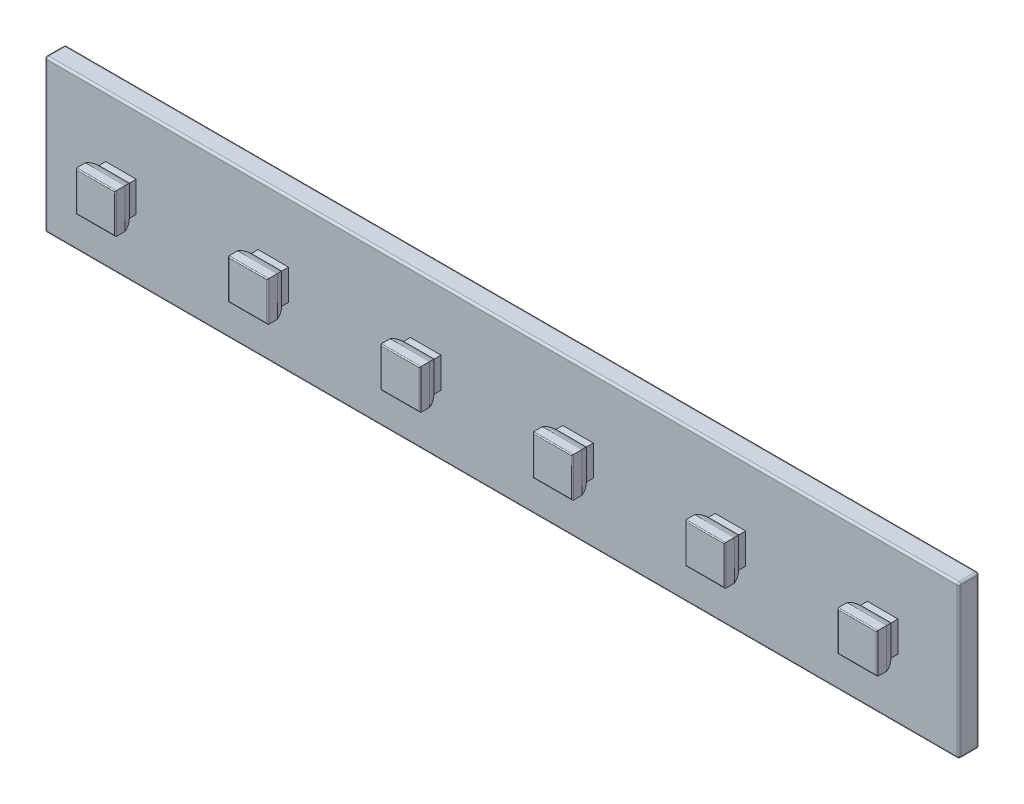
from build123d import *

# Parameters (mm, degrees)
SKETCH_1_W                      = 90
SKETCH_1_H                      = 15
EXTRUDE_1_DEPTH                 = 2
SKETCH_2_W                      = 3
SKETCH_2_H                      = 3
EXTRUDE_2_DEPTH                 = 1
EXTRUDE_3_DEPTH                 = 2
CUT_EXTRUDE_1_REACH             = 84.878
CUT_EXTRUDE_1_DIRECTION_2_REACH = 84.878
FILLET_1_R                      = 0.1
FILLET_1_OF_MIRROR_1_R          = 0.1
FILLET_1_OF_MIRROR_3_R          = 0.1
FILLET_2_R                      = 0.2


# Read off the part's stored shape, not the designer's step: 镜向4
with BuildPart() as part:
    # 草图1 → 凸台-拉伸1 (new body)
    with BuildSketch(Plane.XY):
        with Locations((37.5, 0)):
            Rectangle(SKETCH_1_W, SKETCH_1_H)
    extrude(amount=-EXTRUDE_1_DEPTH)

    # 草图2 → 凸台-拉伸2 (add)
    with BuildSketch(Plane.XY):
        Rectangle(SKETCH_2_W, SKETCH_2_H)
    extrude_2 = extrude(amount=EXTRUDE_2_DEPTH)

    # 草图3 → 凸台-拉伸3 (add, symmetric)
    with BuildSketch(Plane(origin=(0, 0, 0), x_dir=(1, 0, 0), z_dir=(0, 1, 0))):
        with BuildLine():
            Line((-1.95, -2.5), (1.95, -2.5))
            Line((1.95, -2.5), (1.95, -1.555590279))
            ThreePointArc((1.95, -1.555590279), (1.780042303, -1.088161527), (1.5, -0.677124344))
            Line((1.5, -0.677124344), (-1.5, -0.677124344))
            ThreePointArc((-1.5, -0.677124344), (-1.780042303, -1.088161527), (-1.95, -1.555590279))
            Line((-1.95, -1.555590279), (-1.95, -2.5))
        make_face()
    extrude_3 = extrude(amount=EXTRUDE_3_DEPTH, both=True)

    # 草图4 → 切除-拉伸1 (cut, up to next)
    with BuildSketch(Plane(origin=(0, 0, 0), x_dir=(0, 0, -1), z_dir=(1, 0, 0)), mode=Mode.PRIVATE) as cut_extrude_1_sk1:
        with BuildLine():
            Line((-2.5, 1.95), (-1.555590279, 1.95))
            ThreePointArc((-1.555590279, 1.95), (-1.088161527, 1.780042303), (-0.677124344, 1.5))
            Line((-0.677124344, 1.5), (-0.677124344, 2))
            Line((-0.677124344, 2), (-2.5, 2))
            Line((-2.5, 2), (-2.5, 1.95))
        make_face()
    cut_extrude_1_tool1 = extrude(cut_extrude_1_sk1.sketch, amount=-CUT_EXTRUDE_1_REACH, mode=Mode.PRIVATE) & part.part
    # 草图4 → 切除-拉伸1 (cut, up to next)
    with BuildSketch(Plane(origin=(0, 0, 0), x_dir=(0, 0, -1), z_dir=(1, 0, 0)), mode=Mode.PRIVATE) as cut_extrude_1_sk2:
        with BuildLine():
            Line((-2.5, -2), (-0.677124344, -2))
            Line((-0.677124344, -2), (-0.677124344, -1.5))
            ThreePointArc((-0.677124344, -1.5), (-1.088161527, -1.780042303), (-1.555590279, -1.95))
            Line((-1.555590279, -1.95), (-2.5, -1.95))
            Line((-2.5, -1.95), (-2.5, -2))
        make_face()
    cut_extrude_1_tool2 = extrude(cut_extrude_1_sk2.sketch, amount=-CUT_EXTRUDE_1_REACH, mode=Mode.PRIVATE) & part.part
    cut_extrude_1_1 = cut_extrude_1_tool1.solids().sort_by_distance((0, 1.873038, 1.175075))[0]
    add(cut_extrude_1_1, mode=Mode.SUBTRACT)
    cut_extrude_1_2 = cut_extrude_1_tool2.solids().sort_by_distance((0, -1.873038, 1.175075))[0]
    add(cut_extrude_1_2, mode=Mode.SUBTRACT)
    cut_extrude_1 = cut_extrude_1_1 + cut_extrude_1_2  # 切除-拉伸1 as one shape, for the pattern or mirror that repeats it

    # 草图4 → 切除-拉伸1 direction 2 (cut, up to next)
    with BuildSketch(Plane(origin=(0, 0, 0), x_dir=(0, 0, -1), z_dir=(1, 0, 0)), mode=Mode.PRIVATE) as cut_extrude_1_direction_2_sk1:
        with BuildLine():
            Line((-2.5, 1.95), (-1.555590279, 1.95))
            ThreePointArc((-1.555590279, 1.95), (-1.088161527, 1.780042303), (-0.677124344, 1.5))
            Line((-0.677124344, 1.5), (-0.677124344, 2))
            Line((-0.677124344, 2), (-2.5, 2))
            Line((-2.5, 2), (-2.5, 1.95))
        make_face()
    cut_extrude_1_direction_2_tool1 = extrude(cut_extrude_1_direction_2_sk1.sketch, amount=CUT_EXTRUDE_1_DIRECTION_2_REACH, mode=Mode.PRIVATE) & part.part
    # 草图4 → 切除-拉伸1 direction 2 (cut, up to next)
    with BuildSketch(Plane(origin=(0, 0, 0), x_dir=(0, 0, -1), z_dir=(1, 0, 0)), mode=Mode.PRIVATE) as cut_extrude_1_direction_2_sk2:
        with BuildLine():
            Line((-2.5, -2), (-0.677124344, -2))
            Line((-0.677124344, -2), (-0.677124344, -1.5))
            ThreePointArc((-0.677124344, -1.5), (-1.088161527, -1.780042303), (-1.555590279, -1.95))
            Line((-1.555590279, -1.95), (-2.5, -1.95))
            Line((-2.5, -1.95), (-2.5, -2))
        make_face()
    cut_extrude_1_direction_2_tool2 = extrude(cut_extrude_1_direction_2_sk2.sketch, amount=CUT_EXTRUDE_1_DIRECTION_2_REACH, mode=Mode.PRIVATE) & part.part
    cut_extrude_1_direction_2_1 = cut_extrude_1_direction_2_tool1.solids().sort_by_distance((0, 1.873038, 1.175075))[0]
    add(cut_extrude_1_direction_2_1, mode=Mode.SUBTRACT)
    cut_extrude_1_direction_2_2 = cut_extrude_1_direction_2_tool2.solids().sort_by_distance((0, -1.873038, 1.175075))[0]
    add(cut_extrude_1_direction_2_2, mode=Mode.SUBTRACT)
    cut_extrude_1_direction_2 = cut_extrude_1_direction_2_1 + cut_extrude_1_direction_2_2  # 切除-拉伸1 direction 2 as one shape, for the pattern or mirror that repeats it

    # 圆角1
    fillet_1_edges = [part.edges().sort_by_distance(p)[0] for p in [
        (-1.95, 0, 2.5),
        (1.95, 0, 2.5),
        (0, -1.95, 2.5),
        (0, 1.95, 2.5),
    ]]
    fillet(fillet_1_edges, radius=FILLET_1_R)

    # 镜向1: 凸台-拉伸2, 凸台-拉伸3, 切除-拉伸1, 切除-拉伸1 direction 2 across plane
    add(extrude_2.mirror(Plane(origin=(7.5, 0, 0), x_dir=(0, 0, 1), z_dir=(1, 0, 0))))
    add(extrude_3.mirror(Plane(origin=(7.5, 0, 0), x_dir=(0, 0, 1), z_dir=(1, 0, 0))))
    add(cut_extrude_1.mirror(Plane(origin=(7.5, 0, 0), x_dir=(0, 0, 1), z_dir=(1, 0, 0))), mode=Mode.SUBTRACT)
    add(cut_extrude_1_direction_2.mirror(Plane(origin=(7.5, 0, 0), x_dir=(0, 0, 1), z_dir=(1, 0, 0))), mode=Mode.SUBTRACT)

    # 圆角1 of 镜向1
    fillet_1_of_mirror_1_edges = [part.edges().sort_by_distance(p)[0] for p in [
        (16.95, 0, 2.5),
        (13.05, 0, 2.5),
        (15, -1.95, 2.5),
        (15, 1.95, 2.5),
    ]]
    fillet(fillet_1_of_mirror_1_edges, radius=FILLET_1_OF_MIRROR_1_R)

    # 镜向3: 凸台-拉伸2, 凸台-拉伸3, 切除-拉伸1, 切除-拉伸1 direction 2 across plane
    add(extrude_2.mirror(Plane(origin=(15, 0, 0), x_dir=(0, 0, 1), z_dir=(1, 0, 0))))
    add(extrude_3.mirror(Plane(origin=(15, 0, 0), x_dir=(0, 0, 1), z_dir=(1, 0, 0))))
    add(cut_extrude_1.mirror(Plane(origin=(15, 0, 0), x_dir=(0, 0, 1), z_dir=(1, 0, 0))), mode=Mode.SUBTRACT)
    add(cut_extrude_1_direction_2.mirror(Plane(origin=(15, 0, 0), x_dir=(0, 0, 1), z_dir=(1, 0, 0))), mode=Mode.SUBTRACT)

    # 圆角1 of 镜向3
    fillet_1_of_mirror_3_edges = [part.edges().sort_by_distance(p)[0] for p in [
        (31.95, 0, 2.5),
        (28.05, 0, 2.5),
        (30, -1.95, 2.5),
        (30, 1.95, 2.5),
    ]]
    fillet(fillet_1_of_mirror_3_edges, radius=FILLET_1_OF_MIRROR_3_R)

    # 镜向4: part across plane


with BuildPart() as part_1:
    add(part.part)
    add(part.part.mirror(Plane(origin=(37.5, 0, 0), x_dir=(0, 0, 1), z_dir=(1, 0, 0))))

    # 圆角2
    fillet_2_edges = [part_1.edges().sort_by_distance(p)[0] for p in [
        (82.5, 0, -2),
        (37.5, 7.5, -2),
        (-7.5, 0, -2),
        (37.5, 7.5, 0),
        (82.5, 0, 0),
        (37.5, -7.5, 0),
        (-7.5, 0, 0),
        (37.5, -7.5, -2),
        (-7.5, 7.5, -1),
        (82.5, 7.5, -1),
        (82.5, -7.5, -1),
        (-7.5, -7.5, -1),
    ]]
    fillet(fillet_2_edges, radius=FILLET_2_R)


solid = part_1.part
